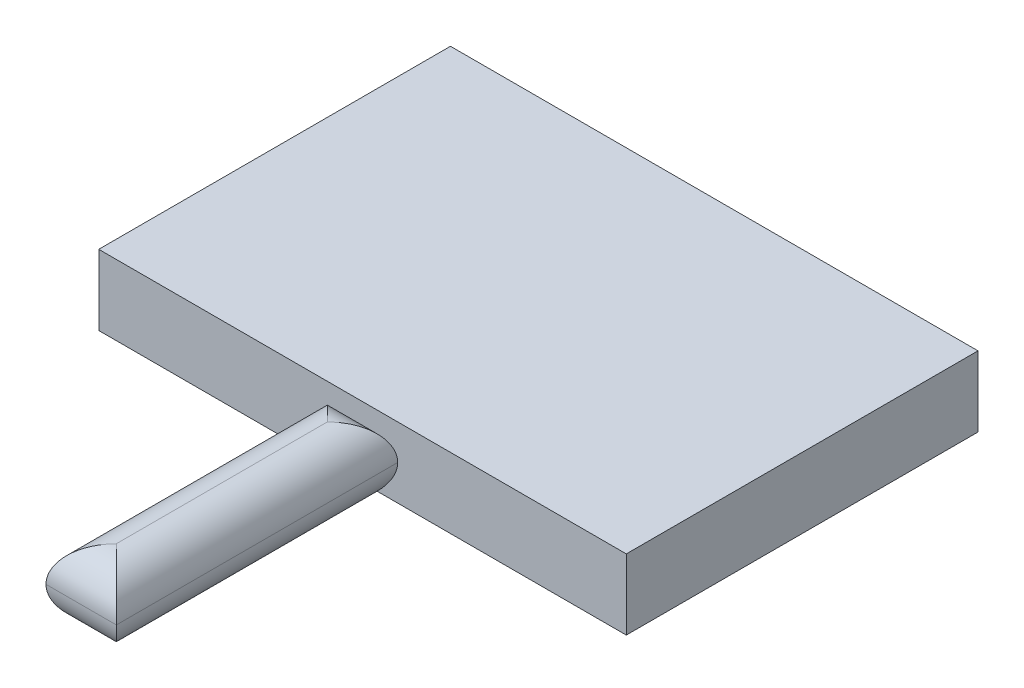
from build123d import *

# Parameters (mm, degrees)
SKETCH1_W           = 15
SKETCH1_H           = 10
BOSS_EXTRUDE1_DEPTH = 2
SKETCH1_3_W         = 2
SKETCH1_3_H         = 8
BOSS_EXTRUDE2_DEPTH = 2
FILLET1_R           = 1


# Read off the part's stored shape, not the designer's step: Split1
with BuildPart() as part:
    # Sketch1 → Boss-Extrude1 (new body)
    with BuildSketch(Plane(origin=(0, 0, 0), x_dir=(1, 0, 0), z_dir=(0, 1, 0))):
        with Locations((7.5, 5)):
            Rectangle(SKETCH1_W, SKETCH1_H)
    extrude(amount=BOSS_EXTRUDE1_DEPTH)

    # Sketch1<3> → Boss-Extrude2 (add)
    with BuildSketch(Plane(origin=(0, 0, 0), x_dir=(1, 0, 0), z_dir=(0, 1, 0))):
        with Locations((7.5, -4)):
            Rectangle(SKETCH1_3_W, SKETCH1_3_H)
    extrude(amount=BOSS_EXTRUDE2_DEPTH)


with BuildPart() as body_2:
    # Split1: the piece on the far side of the plane
    add(part.part)
    split(bisect_by=Plane.XY, keep=Keep.BOTTOM)


with BuildPart() as part_1:
    add(part.part)

    # Split1
    split(bisect_by=Plane.XY, keep=Keep.TOP)

    # Fillet1
    fillet1_edges = [part_1.edges().sort_by_distance(p)[0] for p in [
        (7.5, 0, 8),
        (8.5, 0, 4),
        (6.5, 0, 4),
        (7.5, 2, 8),
        (8.5, 2, 4),
        (6.5, 2, 4),
        (7.5, 0, 0),
        (7.5, 2, 0),
    ]]
    fillet(fillet1_edges, radius=FILLET1_R - 0.0001)  # a hair under: the kernel refuses the full size


solid = Compound([body_2.part, part_1.part])
